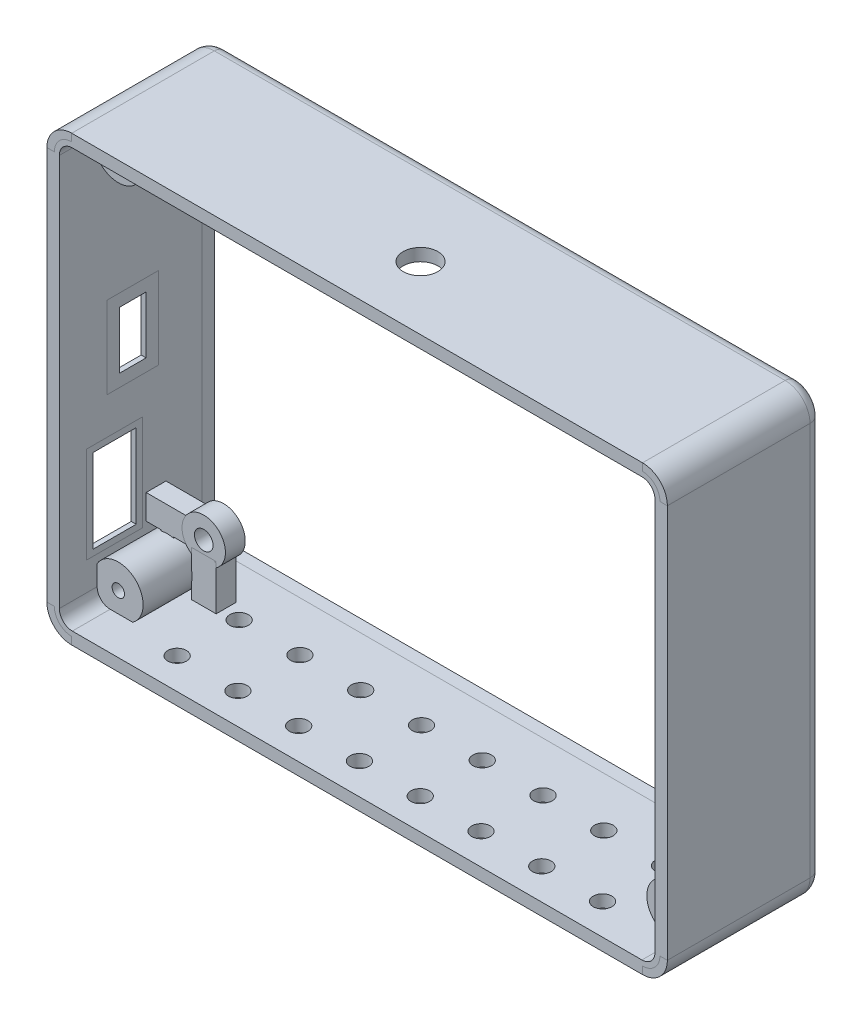
from build123d import *

# Parameters (mm, degrees)
SKIZZE3_W                         = 100.05
SKIZZE3_H                         = 71.475
SKIZZE3_W_2                       = 96.05
SKIZZE3_H_2                       = 67.475
LINEAR_AUSTRAGEN_D_NN1_DEPTH      = 25
VERRUNDUNG1_R                     = 2.1
VERRUNDUNG2_R                     = 4
SKIZZE4_R                         = 3.5
SKIZZE4_R_2                       = 1.5
LINEAR_AUSTRAGEN_D_NN2_DEPTH      = 11
LINEAR_AUSTRAGEN_D_NN2_2_DEPTH    = 11
LINEAR_AUSTRAGEN_D_NN2_3_DEPTH    = 11
LINEAR_AUSTRAGEN_D_NN2_4_DEPTH    = 11
SKIZZE5_R                         = 3.5
SCHNITT_LINEAR_AUSTRAGEN1_DEPTH   = 7.8
SKIZZE6_W                         = 4
SKIZZE6_H                         = 8.131233334
SKIZZE6_W_2                       = 8.09
SKIZZE6_H_2                       = 4
SKIZZE6_W_3                       = 2.46
SKIZZE6_W_4                       = 2
SKIZZE6_H_3                       = 8.303766666
AUFSATZ_LINEAR_AUSTRAGEN2_DEPTH   = 3.2
SKIZZE7_W                         = 4.286045674
SKIZZE7_H                         = 9.20751885
SKIZZE7_W_2                       = 7
SKIZZE7_H_2                       = 13.496277761
SCHNITT_LINEAR_AUSTRAGEN2_DEPTH   = 2
SKIZZE8_R                         = 2.8
SCHNITT_LINEAR_AUSTRAGEN3_DEPTH   = 2
SKIZZE10_R                        = 4
SKIZZE10_R_2                      = 1
LINEAR_AUSTRAGEN_D_NN3_DEPTH      = 18.9
SKIZZE11_W                        = 9.215850747
SKIZZE11_H                        = 8.287078064
SKIZZE11_W_2                      = 7.89566217
SKIZZE11_H_2                      = 8.041954823
SKIZZE11_W_3                      = 8.065038858
SKIZZE11_H_3                      = 8.870541061
SKIZZE11_W_4                      = 9.68835807
SKIZZE11_H_4                      = 7.929972263
SCHNITT_LINEAR_AUSTRAGEN4_DEPTH   = 7.8
SKIZZE12_W                        = 2
SKIZZE12_H                        = 2.813934381
AUFSATZ_LINEAR_AUSTRAGEN3_DEPTH   = 3.2
SCHNITT_LINEAR_START              = -4
SCHNITT_LINEAR_AUSTRAGEN5_DEPTH   = 4
VERRUNDUNG3_R                     = 2.1
SCHNITT_LINEAR_START_2            = -2
SCHNITT_LINEAR_AUSTRAGEN6_DEPTH   = 2
AUFSATZ_LINEAR_AUSTRAGEN4_DEPTH   = 2
VERRUNDUNG4_R                     = 2
SCHNITT_LINEAR_AUSTRAGEN7_DEPTH   = 23
AUFSATZ_LINEAR_AUSTRAGEN5_DEPTH   = 23
AUFSATZ_LINEAR_AUSTRAGEN5_2_DEPTH = 23
AUFSATZ_LINEAR_AUSTRAGEN5_3_DEPTH = 23
AUFSATZ_LINEAR_AUSTRAGEN5_4_DEPTH = 23
SKIZZE16_W                        = 8.286045674
SKIZZE16_H                        = 13.20751885
SKIZZE16_W_2                      = 9
SKIZZE16_H_2                      = 15.496277761
SCHNITT_LINEAR_AUSTRAGEN8_DEPTH   = 1.2
VERRUNDUNG6_R                     = 1
SKIZZE17_W                        = 8.286045674
SKIZZE17_H                        = 13.20751885
SKIZZE17_W_2                      = 4.286045674
SKIZZE17_H_2                      = 9.20751885
SKIZZE17_W_3                      = 9
SKIZZE17_H_3                      = 15.496277761
SKIZZE17_W_4                      = 7
SKIZZE17_H_4                      = 13.496277761
SCHNITT_LINEAR_AUSTRAGEN9_DEPTH   = 0.8
SKIZZE17_2_W                      = 8.286045674
SKIZZE17_2_H                      = 13.20751885
SKIZZE17_2_W_2                    = 4.286045674
SKIZZE17_2_H_2                    = 9.20751885
AUFSATZ_LINEAR_AUSTRAGEN6_DEPTH   = 0.8
SKIZZE17_2_W_3                    = 9
SKIZZE17_2_H_3                    = 15.496277761
SKIZZE17_2_W_4                    = 7
SKIZZE17_2_H_4                    = 13.496277761
AUFSATZ_LINEAR_AUSTRAGEN6_2_DEPTH = 0.8
SKIZZE18_R                        = 1.5
SCHNITT_LINEAR_AUSTRAGEN10_DEPTH  = 2
SKIZZE19_W                        = 3
SKIZZE19_H                        = 22.8
AUFSATZ_LINEAR_AUSTRAGEN7_DEPTH   = 2
FASE1_SIZE                        = 2


with BuildPart() as part:
    # Skizze3 → Linear-Austragen-Dünn1 (new body)
    with BuildSketch(Plane.XY):
        with Locations((-39.24267695, -2.645215869)):
            Rectangle(SKIZZE3_W, SKIZZE3_H)
        with Locations((-39.24267695, -2.645215869)):
            Rectangle(SKIZZE3_W_2, SKIZZE3_H_2, mode=Mode.SUBTRACT)
    extrude(amount=LINEAR_AUSTRAGEN_D_NN1_DEPTH)

    # Verrundung1
    verrundung1_edges = [part.edges().sort_by_distance(p)[0] for p in [
        (-87.26767695, 31.092284131, 12.5),
        (-87.26767695, -36.382715869, 12.5),
        (8.78232305, -36.382715869, 12.5),
        (8.78232305, 31.092284131, 12.5),
    ]]
    fillet(verrundung1_edges, radius=VERRUNDUNG1_R)

    # Verrundung2
    verrundung2_edges = [part.edges().sort_by_distance(p)[0] for p in [
        (-89.26767695, 33.092284131, 12.5),
        (10.78232305, 33.092284131, 12.5),
        (10.78232305, -38.382715869, 12.5),
        (-89.26767695, -38.382715869, 12.5),
    ]]
    fillet(verrundung2_edges, radius=VERRUNDUNG2_R)


with BuildPart() as body_2:
    # Skizze4 → Linear-Austragen-Dünn2 (new body)
    with BuildSketch(Plane.XY):
        with Locations((-77.97767695, 21.961050797)):
            Circle(SKIZZE4_R)
        with Locations((-77.97767695, 21.961050797)):
            Circle(SKIZZE4_R_2, mode=Mode.SUBTRACT)
    extrude(amount=LINEAR_AUSTRAGEN_D_NN2_DEPTH)


with BuildPart() as body_3:
    # Skizze4 → Linear-Austragen-D_nn2 2 (new body)
    with BuildSketch(Plane.XY):
        with Locations((5.32232305, 21.961050797)):
            Circle(SKIZZE4_R)
        with Locations((5.32232305, 21.961050797)):
            Circle(SKIZZE4_R_2, mode=Mode.SUBTRACT)
    extrude(amount=LINEAR_AUSTRAGEN_D_NN2_2_DEPTH)


with BuildPart() as body_4:
    # Skizze4 → Linear-Austragen-D_nn2 3 (new body)
    with BuildSketch(Plane.XY):
        with Locations((-77.97767695, -27.078949203)):
            Circle(SKIZZE4_R)
        with Locations((-77.97767695, -27.078949203)):
            Circle(SKIZZE4_R_2, mode=Mode.SUBTRACT)
    extrude(amount=LINEAR_AUSTRAGEN_D_NN2_3_DEPTH)


with BuildPart() as body_5:
    # Skizze4 → Linear-Austragen-D_nn2 4 (new body)
    with BuildSketch(Plane.XY):
        with Locations((5.32232305, -27.078949203)):
            Circle(SKIZZE4_R)
        with Locations((5.32232305, -27.078949203)):
            Circle(SKIZZE4_R_2, mode=Mode.SUBTRACT)
    extrude(amount=LINEAR_AUSTRAGEN_D_NN2_4_DEPTH)


with BuildPart() as schnitt_linear_austragen1_tool:
    # Skizze5 → Schnitt-Linear austragen1 (new body)
    with BuildSketch(Plane(origin=(0, 0, 0), x_dir=(-1, 0, 0), z_dir=(0, 0, -1))):
        with Locations((-5.32232305, 21.961050797)):
            Circle(SKIZZE5_R)
        with Locations((-5.32232305, -27.078949203)):
            Circle(SKIZZE5_R)
        with Locations((77.97767695, -27.078949203)):
            Circle(SKIZZE5_R)
        with Locations((77.97767695, 21.961050797)):
            Circle(SKIZZE5_R)
    extrude(amount=-SCHNITT_LINEAR_AUSTRAGEN1_DEPTH)


with BuildPart() as part_1:
    add(part.part)

    # Schnitt-Linear austragen1: cut by schnitt_linear_austragen1_tool
    add(schnitt_linear_austragen1_tool.part, mode=Mode.SUBTRACT)



with BuildPart() as body_2_1:
    add(body_2.part)

    # Schnitt-Linear austragen1: cut by schnitt_linear_austragen1_tool
    add(schnitt_linear_austragen1_tool.part, mode=Mode.SUBTRACT)


with BuildPart() as body_3_1:
    add(body_3.part)

    # Schnitt-Linear austragen1: cut by schnitt_linear_austragen1_tool
    add(schnitt_linear_austragen1_tool.part, mode=Mode.SUBTRACT)


with BuildPart() as body_4_1:
    add(body_4.part)

    # Schnitt-Linear austragen1: cut by schnitt_linear_austragen1_tool
    add(schnitt_linear_austragen1_tool.part, mode=Mode.SUBTRACT)


with BuildPart() as body_5_1:
    add(body_5.part)

    # Schnitt-Linear austragen1: cut by schnitt_linear_austragen1_tool
    add(schnitt_linear_austragen1_tool.part, mode=Mode.SUBTRACT)


with BuildPart() as part_2:
    add(part_1.part)

    add(body_3_1.part)  # Aufsatz-Linear austragen2 merges body 3
    # Skizze6 → Aufsatz-Linear austragen2 (add)
    with BuildSketch(Plane.XY.offset(11)):
        with Locations((-77.97767695, 28.026667464)):
            Rectangle(SKIZZE6_W, SKIZZE6_H)
        with Locations((-84.22267695, 21.961050797)):
            Rectangle(SKIZZE6_W_2, SKIZZE6_H_2)
        with Locations((8.55232305, 21.961050797)):
            Rectangle(SKIZZE6_W_3, SKIZZE6_H_2)
        with Locations((5.32232305, 28.026667464)):
            Rectangle(SKIZZE6_W_4, SKIZZE6_H)
        with Locations((-84.22267695, -27.078949203)):
            Rectangle(SKIZZE6_W_2, SKIZZE6_H_2)
        with Locations((-77.97767695, -33.230832536)):
            Rectangle(SKIZZE6_W, SKIZZE6_H_3)
        with Locations((8.55232305, -27.078949203)):
            Rectangle(SKIZZE6_W_3, SKIZZE6_H_2)
        with Locations((5.32232305, -33.230832536)):
            Rectangle(SKIZZE6_W_4, SKIZZE6_H_3)
    extrude(amount=-AUFSATZ_LINEAR_AUSTRAGEN2_DEPTH)

    # Skizze7 → Schnitt-Linear austragen2 (cut)
    with BuildSketch(Plane.ZY.offset(89.26767695)):
        with Locations((13.143022837, -1.675300693)):
            Rectangle(SKIZZE7_W, SKIZZE7_H)
        with Locations((16.1, -21.968913054)):
            Rectangle(SKIZZE7_W_2, SKIZZE7_H_2)
    extrude(amount=-SCHNITT_LINEAR_AUSTRAGEN2_DEPTH, mode=Mode.SUBTRACT)

    # Skizze8 → Schnitt-Linear austragen3 (cut)
    with BuildSketch(Plane(origin=(0, 33.092284131, 0), x_dir=(1, 0, 0), z_dir=(0, 1, 0))):
        with Locations(Location((-39.21767695, -14.8, 0), (0, 0, 270))):
            Circle(SKIZZE8_R)
    extrude(amount=-SCHNITT_LINEAR_AUSTRAGEN3_DEPTH, mode=Mode.SUBTRACT)

    # Skizze10 → Linear-Austragen-Dünn3 (add)
    # profile 1 of 4: a face of its own
    with BuildSketch(Plane.XY):
        with Locations((-83.851410283, 27.834784131)):
            Circle(SKIZZE10_R)
        with Locations((-83.851410283, 27.834784131)):
            Circle(SKIZZE10_R_2, mode=Mode.SUBTRACT)
    # profile 2 of 4: a face of its own
    with BuildSketch(Plane.XY):
        with Locations((-83.851410283, -33.125215869)):
            Circle(SKIZZE10_R)
        with Locations((-83.851410283, -33.125215869)):
            Circle(SKIZZE10_R_2, mode=Mode.SUBTRACT)
    # profile 3 of 4: a face of its own
    with BuildSketch(Plane.XY):
        with Locations((5.366089717, -33.125215869)):
            Circle(SKIZZE10_R)
        with Locations((5.366089717, -33.125215869)):
            Circle(SKIZZE10_R_2, mode=Mode.SUBTRACT)
    # profile 4 of 4: a face of its own
    with BuildSketch(Plane.XY):
        with Locations((5.366089717, 27.993517464)):
            Circle(SKIZZE10_R)
        with Locations((5.366089717, 27.993517464)):
            Circle(SKIZZE10_R_2, mode=Mode.SUBTRACT)
    extrude(amount=LINEAR_AUSTRAGEN_D_NN3_DEPTH)

    # Skizze11 → Schnitt-Linear austragen4 (cut)
    with BuildSketch(Plane(origin=(0, 0, 0), x_dir=(-1, 0, 0), z_dir=(0, 0, -1))):
        with Locations((-4.174397676, 26.948745099)):
            Rectangle(SKIZZE11_W, SKIZZE11_H)
        with Locations((83.319845865, 27.07130672)):
            Rectangle(SKIZZE11_W_2, SKIZZE11_H_2)
        with Locations((83.235157521, -31.947445339)):
            Rectangle(SKIZZE11_W_3, SKIZZE11_H_3)
        with Locations((-3.938144015, -32.417729738)):
            Rectangle(SKIZZE11_W_4, SKIZZE11_H_4)
    extrude(amount=-SCHNITT_LINEAR_AUSTRAGEN4_DEPTH, mode=Mode.SUBTRACT)

    # Skizze12 → Aufsatz-Linear austragen3 (add)
    with BuildSketch(Plane(origin=(0, 0, 7.8), x_dir=(-1, 0, 0), z_dir=(0, 0, -1))):
        with Locations((83.851410283, -29.269727087)):
            Rectangle(SKIZZE12_W, SKIZZE12_H)
    extrude(amount=-AUFSATZ_LINEAR_AUSTRAGEN3_DEPTH)

    # Skizze13 → Schnitt-Linear austragen5 (cut)
    with BuildSketch(Plane.XY.offset(11).offset(SCHNITT_LINEAR_START)):
        with BuildLine():
            Line((6.32232305, 27.700912248), (6.32232305, 28.28612268))
            ThreePointArc((6.32232305, 28.28612268), (4.366089717, 27.993517464), (6.32232305, 27.700912248))
        make_face()
        with BuildLine():
            Line((6.32232305, -33.417821085), (6.32232305, -32.832610654))
            ThreePointArc((6.32232305, -32.832610654), (4.366089717, -33.125215869), (6.32232305, -33.417821085))
        make_face()
    extrude(amount=SCHNITT_LINEAR_AUSTRAGEN5_DEPTH, mode=Mode.SUBTRACT)

    # Verrundung3
    verrundung3_edges = [part_2.edges().sort_by_distance(p)[0] for p in [
        (8.78232305, 31.092284131, 3.9),
        (-87.26767695, 31.092284131, 3.9),
        (-87.26767695, -36.382715869, 3.9),
        (8.78232305, -36.382715869, 3.9),
    ]]
    fillet(verrundung3_edges, radius=VERRUNDUNG3_R)

    # Skizze14 → Schnitt-Linear austragen6 (cut)
    with BuildSketch(Plane(origin=(0, 0, 0), x_dir=(-1, 0, 0), z_dir=(0, 0, -1)).offset(SCHNITT_LINEAR_START_2)):
        with BuildLine():
            Line((-10.78232305, 29.092284131), (-10.78232305, -34.382715869))
            ThreePointArc((-10.78232305, -34.382715869), (-9.610750175, -37.211142994), (-6.78232305, -38.382715869))
            Line((-6.78232305, -38.382715869), (85.26767695, -38.382715869))
            ThreePointArc((85.26767695, -38.382715869), (88.096104074, -37.211142994), (89.26767695, -34.382715869))
            Line((89.26767695, -34.382715869), (89.26767695, 29.092284131))
            ThreePointArc((89.26767695, 29.092284131), (88.096104074, 31.920711255), (85.26767695, 33.092284131))
            Line((85.26767695, 33.092284131), (-6.78232305, 33.092284131))
            ThreePointArc((-6.78232305, 33.092284131), (-9.610750175, 31.920711255), (-10.78232305, 29.092284131))
        make_face()
        with BuildLine():
            Line((85.16767695, -36.382715869), (-6.68232305, -36.382715869))
            ThreePointArc((-6.68232305, -36.382715869), (-8.167247291, -35.76764011), (-8.78232305, -34.282715869))
            Line((-8.78232305, -34.282715869), (-8.78232305, -27.606585441))
            ThreePointArc((-8.78232305, -27.606585441), (-8.82232305, -27.078949203), (-8.78232305, -26.551312964))
            Line((-8.78232305, -26.551312964), (-8.78232305, 21.433414559))
            ThreePointArc((-8.78232305, 21.433414559), (-8.82232305, 21.961050797), (-8.78232305, 22.488687036))
            Line((-8.78232305, 22.488687036), (-8.78232305, 28.992284131))
            ThreePointArc((-8.78232305, 28.992284131), (-8.167247291, 30.477208371), (-6.68232305, 31.092284131))
            Line((-6.68232305, 31.092284131), (85.16767695, 31.092284131))
            ThreePointArc((85.16767695, 31.092284131), (86.65260119, 30.477208371), (87.26767695, 28.992284131))
            Line((87.26767695, 28.992284131), (87.26767695, -34.282715869))
            ThreePointArc((87.26767695, -34.282715869), (86.65260119, -35.76764011), (85.16767695, -36.382715869))
        make_face(mode=Mode.SUBTRACT)
    extrude(amount=SCHNITT_LINEAR_AUSTRAGEN6_DEPTH, mode=Mode.SUBTRACT)

    # Skizze15 → Schnitt-Linear austragen7 (cut)
    with BuildSketch(Plane.XY.offset(25)):
        with BuildLine():
            Line((-85.26767695, 33.092284131), (-85.26767695, 31.892284131))
            ThreePointArc((-85.26767695, 31.892284131), (-87.247575937, 31.072183118), (-88.06767695, 29.092284131))
            Line((-88.06767695, 29.092284131), (-89.26767695, 29.092284131))
            ThreePointArc((-89.26767695, 29.092284131), (-88.096104074, 31.920711255), (-85.26767695, 33.092284131))
        make_face()
        with BuildLine():
            Line((6.78232305, 31.892284131), (6.78232305, 33.092284131))
            ThreePointArc((6.78232305, 33.092284131), (9.610750175, 31.920711255), (10.78232305, 29.092284131))
            Line((10.78232305, 29.092284131), (9.58232305, 29.092284131))
            ThreePointArc((9.58232305, 29.092284131), (8.762222038, 31.072183118), (6.78232305, 31.892284131))
        make_face()
        with BuildLine():
            Line((9.58232305, -34.382715869), (10.78232305, -34.382715869))
            ThreePointArc((10.78232305, -34.382715869), (9.610750175, -37.211142994), (6.78232305, -38.382715869))
            Line((6.78232305, -38.382715869), (6.78232305, -37.182715869))
            ThreePointArc((6.78232305, -37.182715869), (8.762222038, -36.362614857), (9.58232305, -34.382715869))
        make_face()
        with BuildLine():
            Line((-88.06767695, -34.382715869), (-89.26767695, -34.382715869))
            ThreePointArc((-89.26767695, -34.382715869), (-88.096104074, -37.211142994), (-85.26767695, -38.382715869))
            Line((-85.26767695, -38.382715869), (-85.26767695, -37.182715869))
            ThreePointArc((-85.26767695, -37.182715869), (-87.247575937, -36.362614857), (-88.06767695, -34.382715869))
        make_face()
    extrude(amount=-SCHNITT_LINEAR_AUSTRAGEN7_DEPTH, mode=Mode.SUBTRACT)

    # Skizze16 → Schnitt-Linear austragen8 (cut)
    with BuildSketch(Plane.ZY.offset(89.26767695)):
        with Locations((13.143022837, -1.675300693)):
            Rectangle(SKIZZE16_W, SKIZZE16_H)
        with Locations((16.1, -21.968913054)):
            Rectangle(SKIZZE16_W_2, SKIZZE16_H_2)
    extrude(amount=-SCHNITT_LINEAR_AUSTRAGEN8_DEPTH, mode=Mode.SUBTRACT)

    # Verrundung6
    verrundung6_edges = [part_2.edges().sort_by_distance(p)[0] for p in [
        (-89.26767695, -1.675300693, 9),
        (-89.26767695, -8.279060118, 13.143022837),
        (-89.26767695, -1.675300693, 17.286045674),
        (-89.26767695, 4.928458732, 13.143022837),
        (-89.26767695, -21.968913054, 11.6),
        (-89.26767695, -29.717051935, 16.1),
        (-89.26767695, -21.968913054, 20.6),
        (-89.26767695, -14.220774174, 16.1),
    ]]
    fillet(verrundung6_edges, radius=VERRUNDUNG6_R)

    # Skizze17 → Schnitt-Linear austragen9 (cut)
    # profile 1 of 2: a face of its own
    with BuildSketch(Plane.ZY.offset(88.06767695)):
        with Locations((13.143022837, -1.675300693)):
            Rectangle(SKIZZE17_W, SKIZZE17_H)
        with Locations((13.143022837, -1.675300693)):
            Rectangle(SKIZZE17_W_2, SKIZZE17_H_2, mode=Mode.SUBTRACT)
    # profile 2 of 2: a face of its own
    with BuildSketch(Plane.ZY.offset(88.06767695)):
        with Locations((16.1, -21.968913054)):
            Rectangle(SKIZZE17_W_3, SKIZZE17_H_3)
        with Locations((16.1, -21.968913054)):
            Rectangle(SKIZZE17_W_4, SKIZZE17_H_4, mode=Mode.SUBTRACT)
    extrude(amount=-SCHNITT_LINEAR_AUSTRAGEN9_DEPTH, mode=Mode.SUBTRACT)

    # Skizze18 → Schnitt-Linear austragen10 (cut)
    with BuildSketch(Plane.XZ.offset(38.382715869)):
        with Locations(Location((-73.26767695, 20, 0), (0, 0, 270))):
            Circle(SKIZZE18_R)
        with Locations(Location((-63.46767695, 20, 0), (0, 0, 270))):
            Circle(SKIZZE18_R)
        with Locations(Location((-53.66767695, 20, 0), (0, 0, 270))):
            Circle(SKIZZE18_R)
        with Locations(Location((-43.86767695, 20, 0), (0, 0, 270))):
            Circle(SKIZZE18_R)
        with Locations(Location((-34.06767695, 20, 0), (0, 0, 270))):
            Circle(SKIZZE18_R)
        with Locations(Location((-24.26767695, 20, 0), (0, 0, 270))):
            Circle(SKIZZE18_R)
        with Locations(Location((-14.46767695, 20, 0), (0, 0, 270))):
            Circle(SKIZZE18_R)
        with Locations(Location((-4.66767695, 20, 0), (0, 0, 270))):
            Circle(SKIZZE18_R)
        with Locations(Location((-63.46767695, 10, 0), (0, 0, 270))):
            Circle(SKIZZE18_R)
        with Locations(Location((-53.66767695, 10, 0), (0, 0, 270))):
            Circle(SKIZZE18_R)
        with Locations(Location((-43.86767695, 10, 0), (0, 0, 270))):
            Circle(SKIZZE18_R)
        with Locations(Location((-34.06767695, 10, 0), (0, 0, 270))):
            Circle(SKIZZE18_R)
        with Locations(Location((-24.26767695, 10, 0), (0, 0, 270))):
            Circle(SKIZZE18_R)
        with Locations(Location((-14.46767695, 10, 0), (0, 0, 270))):
            Circle(SKIZZE18_R)
        with Locations(Location((-4.66767695, 10, 0), (0, 0, 270))):
            Circle(SKIZZE18_R)
        with Locations(Location((-73.26767695, 10, 0), (0, 0, 270))):
            Circle(SKIZZE18_R)
    extrude(amount=-SCHNITT_LINEAR_AUSTRAGEN10_DEPTH, mode=Mode.SUBTRACT)

    # Skizze19 → Aufsatz-Linear austragen7 (add)
    with BuildSketch(Plane.XZ.offset(38.382715869)):
        with Locations((3.28232305, 13.5)):
            Rectangle(SKIZZE19_W, SKIZZE19_H)
        with Locations((-81.76767695, 13.5)):
            Rectangle(SKIZZE19_W, SKIZZE19_H)
    extrude(amount=AUFSATZ_LINEAR_AUSTRAGEN7_DEPTH)

    # Fase1
    fase1_edges = [part_2.edges().sort_by_distance(p)[0] for p in [
        (3.28232305, -40.382715869, 24.9),
        (3.28232305, -40.382715869, 2.1),
        (-81.76767695, -40.382715869, 24.9),
        (-81.76767695, -40.382715869, 2.1),
    ]]
    chamfer(fase1_edges, length=FASE1_SIZE - 0.0001)  # a hair under: the kernel refuses the full size


with BuildPart() as body_5_2:
    # Skizze14<2> → Aufsatz-Linear austragen4 (new body)
    with BuildSketch(Plane(origin=(0, 0, 0), x_dir=(-1, 0, 0), z_dir=(0, 0, -1))):
        with BuildLine():
            Line((-10.78232305, 29.092284131), (-10.78232305, -34.382715869))
            ThreePointArc((-10.78232305, -34.382715869), (-9.610750175, -37.211142994), (-6.78232305, -38.382715869))
            Line((-6.78232305, -38.382715869), (85.26767695, -38.382715869))
            ThreePointArc((85.26767695, -38.382715869), (88.096104074, -37.211142994), (89.26767695, -34.382715869))
            Line((89.26767695, -34.382715869), (89.26767695, 29.092284131))
            ThreePointArc((89.26767695, 29.092284131), (88.096104074, 31.920711255), (85.26767695, 33.092284131))
            Line((85.26767695, 33.092284131), (-6.78232305, 33.092284131))
            ThreePointArc((-6.78232305, 33.092284131), (-9.610750175, 31.920711255), (-10.78232305, 29.092284131))
        make_face()
        with BuildLine():
            Line((85.16767695, -36.382715869), (-6.68232305, -36.382715869))
            ThreePointArc((-6.68232305, -36.382715869), (-8.167247291, -35.76764011), (-8.78232305, -34.282715869))
            Line((-8.78232305, -34.282715869), (-8.78232305, -27.606585441))
            ThreePointArc((-8.78232305, -27.606585441), (-8.82232305, -27.078949203), (-8.78232305, -26.551312964))
            Line((-8.78232305, -26.551312964), (-8.78232305, 21.433414559))
            ThreePointArc((-8.78232305, 21.433414559), (-8.82232305, 21.961050797), (-8.78232305, 22.488687036))
            Line((-8.78232305, 22.488687036), (-8.78232305, 28.992284131))
            ThreePointArc((-8.78232305, 28.992284131), (-8.167247291, 30.477208371), (-6.68232305, 31.092284131))
            Line((-6.68232305, 31.092284131), (85.16767695, 31.092284131))
            ThreePointArc((85.16767695, 31.092284131), (86.65260119, 30.477208371), (87.26767695, 28.992284131))
            Line((87.26767695, 28.992284131), (87.26767695, -34.282715869))
            ThreePointArc((87.26767695, -34.282715869), (86.65260119, -35.76764011), (85.16767695, -36.382715869))
        make_face(mode=Mode.SUBTRACT)
    extrude(amount=-AUFSATZ_LINEAR_AUSTRAGEN4_DEPTH)

    # Verrundung4
    verrundung4_edges = [body_5_2.edges().sort_by_distance(p)[0] for p in [
        (9.610750175, 31.920711255, 0),
        (10.78232305, -2.645215869, 0),
        (9.610750175, -37.211142994, 0),
        (-88.096104074, -37.211142994, 0),
        (-39.24267695, -38.382715869, 0),
        (-89.26767695, -2.645215869, 0),
        (-88.096104074, 31.920711255, 0),
        (-39.24267695, 33.092284131, 0),
    ]]
    fillet(verrundung4_edges, radius=VERRUNDUNG4_R - 0.0001)  # a hair under: the kernel refuses the full size


with BuildPart() as body_6:
    # Skizze15<2> → Aufsatz-Linear austragen5 (new body)
    with BuildSketch(Plane.XY.offset(25)):
        with BuildLine():
            Line((-85.26767695, 33.092284131), (-85.26767695, 31.892284131))
            ThreePointArc((-85.26767695, 31.892284131), (-87.247575937, 31.072183118), (-88.06767695, 29.092284131))
            Line((-88.06767695, 29.092284131), (-89.26767695, 29.092284131))
            ThreePointArc((-89.26767695, 29.092284131), (-88.096104074, 31.920711255), (-85.26767695, 33.092284131))
        make_face()
    extrude(amount=-AUFSATZ_LINEAR_AUSTRAGEN5_DEPTH)


with BuildPart() as body_7:
    # Skizze15<2> → Aufsatz-Linear austragen5 2 (new body)
    with BuildSketch(Plane.XY.offset(25)):
        with BuildLine():
            Line((6.78232305, 31.892284131), (6.78232305, 33.092284131))
            ThreePointArc((6.78232305, 33.092284131), (9.610750175, 31.920711255), (10.78232305, 29.092284131))
            Line((10.78232305, 29.092284131), (9.58232305, 29.092284131))
            ThreePointArc((9.58232305, 29.092284131), (8.762222038, 31.072183118), (6.78232305, 31.892284131))
        make_face()
    extrude(amount=-AUFSATZ_LINEAR_AUSTRAGEN5_2_DEPTH)


with BuildPart() as body_8:
    # Skizze15<2> → Aufsatz-Linear austragen5 3 (new body)
    with BuildSketch(Plane.XY.offset(25)):
        with BuildLine():
            Line((9.58232305, -34.382715869), (10.78232305, -34.382715869))
            ThreePointArc((10.78232305, -34.382715869), (9.610750175, -37.211142994), (6.78232305, -38.382715869))
            Line((6.78232305, -38.382715869), (6.78232305, -37.182715869))
            ThreePointArc((6.78232305, -37.182715869), (8.762222038, -36.362614857), (9.58232305, -34.382715869))
        make_face()
    extrude(amount=-AUFSATZ_LINEAR_AUSTRAGEN5_3_DEPTH)


with BuildPart() as body_9:
    # Skizze15<2> → Aufsatz-Linear austragen5 4 (new body)
    with BuildSketch(Plane.XY.offset(25)):
        with BuildLine():
            Line((-88.06767695, -34.382715869), (-89.26767695, -34.382715869))
            ThreePointArc((-89.26767695, -34.382715869), (-88.096104074, -37.211142994), (-85.26767695, -38.382715869))
            Line((-85.26767695, -38.382715869), (-85.26767695, -37.182715869))
            ThreePointArc((-85.26767695, -37.182715869), (-87.247575937, -36.362614857), (-88.06767695, -34.382715869))
        make_face()
    extrude(amount=-AUFSATZ_LINEAR_AUSTRAGEN5_4_DEPTH)


with BuildPart() as body_10:
    # Skizze17<2> → Aufsatz-Linear austragen6 (new body)
    with BuildSketch(Plane.ZY.offset(88.06767695)):
        with Locations((13.143022837, -1.675300693)):
            Rectangle(SKIZZE17_2_W, SKIZZE17_2_H)
        with Locations((13.143022837, -1.675300693)):
            Rectangle(SKIZZE17_2_W_2, SKIZZE17_2_H_2, mode=Mode.SUBTRACT)
    extrude(amount=-AUFSATZ_LINEAR_AUSTRAGEN6_DEPTH)


with BuildPart() as body_11:
    # Skizze17<2> → Aufsatz-Linear austragen6 2 (new body)
    with BuildSketch(Plane.ZY.offset(88.06767695)):
        with Locations((16.1, -21.968913054)):
            Rectangle(SKIZZE17_2_W_3, SKIZZE17_2_H_3)
        with Locations((16.1, -21.968913054)):
            Rectangle(SKIZZE17_2_W_4, SKIZZE17_2_H_4, mode=Mode.SUBTRACT)
    extrude(amount=-AUFSATZ_LINEAR_AUSTRAGEN6_2_DEPTH)


solid = Compound([body_2_1.part, body_4_1.part, body_5_1.part, part_2.part, body_5_2.part, body_6.part, body_7.part, body_8.part, body_9.part, body_10.part, body_11.part])
